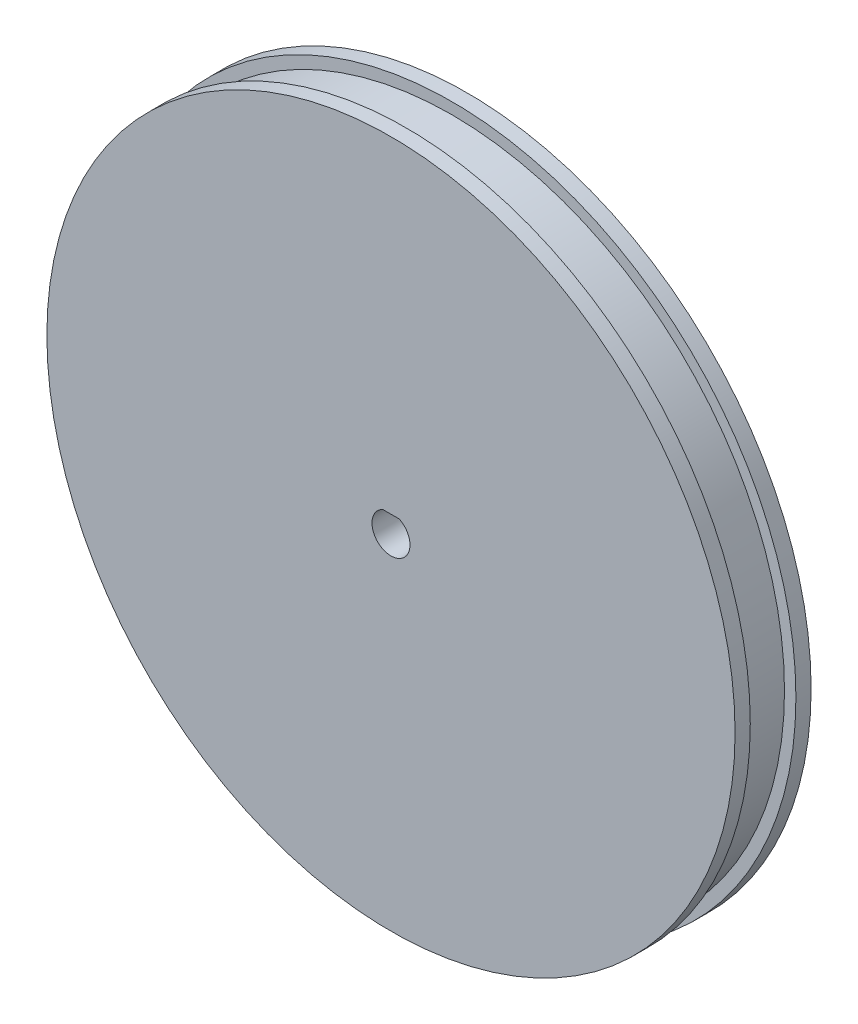
from build123d import *

# Parameters (mm, degrees)
SKIZZE2_R         = 43.75
ZAHNFL_CHE_DEPTH  = 6
SKIZZE4_R         = 45.25
SEITENTEIL1_DEPTH = 2
SEITENTEIL2_START = 2
SKIZZE5_R         = 45.25
SEITENTEIL2_DEPTH = 2
AUSSPARUNG_DEPTH  = 65.769784622


with BuildPart() as part:
    # Skizze2 → Zahnfläche (new body)
    with BuildSketch(Plane.XY):
        Circle(SKIZZE2_R)
    extrude(amount=ZAHNFL_CHE_DEPTH)

    # Skizze4 → Seitenteil1 (add)
    with BuildSketch(Plane(origin=(0, 0, 0), x_dir=(-1, 0, 0), z_dir=(0, 0, -1))):
        Circle(SKIZZE4_R)
    extrude(amount=SEITENTEIL1_DEPTH)

    # Skizze5 → Seitenteil2 (add)
    with BuildSketch(Plane.XY.offset(6).offset(SEITENTEIL2_START)):
        Circle(SKIZZE5_R)
    extrude(amount=-SEITENTEIL2_DEPTH)

    # Skizze6 → Aussparung (cut, through all)
    with BuildSketch(Plane.XY.offset(8)):
        with BuildLine():
            Line((-1.089724736, 2.25), (1.089724736, 2.25))
            ThreePointArc((1.089724736, 2.25), (0, -2.5), (-1.089724736, 2.25))
        make_face()
    extrude(amount=-AUSSPARUNG_DEPTH, mode=Mode.SUBTRACT)


solid = part.part
